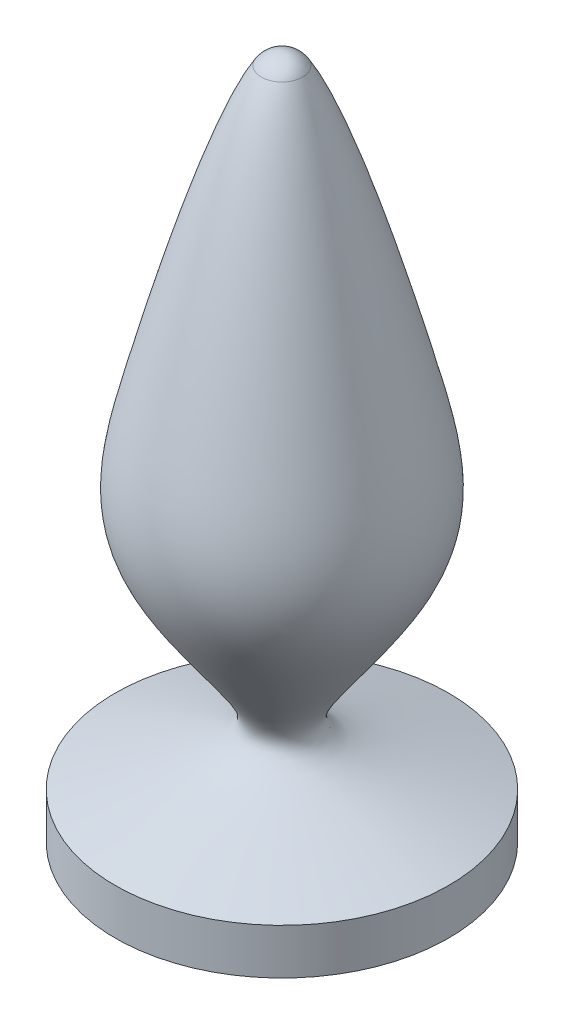
from build123d import *


with BuildPart() as part:
    # Sketch1 → Revolve1 (revolve)
    with BuildSketch(Plane.XY):
        with BuildLine():
            Line((0, -71.377172013), (0, 0))
            ThreePointArc((0, 0), (1.223734169, -0.314224925), (2.144690561, -1.179153793))
            add(Edge.make_bspline(
                [(2.144690561, -1.179153793), (4.702836967, -5.210786776), (8.980036974, -18.882117933), (14.526259951, -40.98152643), (12.27166851, -46.216037015), (1.146217403, -61.924501885), (0.738552126, -60.947926468), (17.399, -66.614672013)],
                knots=[0.105965392, 0.105965392, 0.105965392, 0.105965392, 0.448012953, 0.508175246, 0.685431315, 0.718366342, 1, 1, 1, 1], degree=3))
            Line((17.399, -66.614672013), (17.399, -71.377172013))
            Line((17.399, -71.377172013), (0, -71.377172013))
        make_face()
    revolve(axis=Axis((0, -71.377172013, 0), (0, 1, 0)))


solid = part.part
